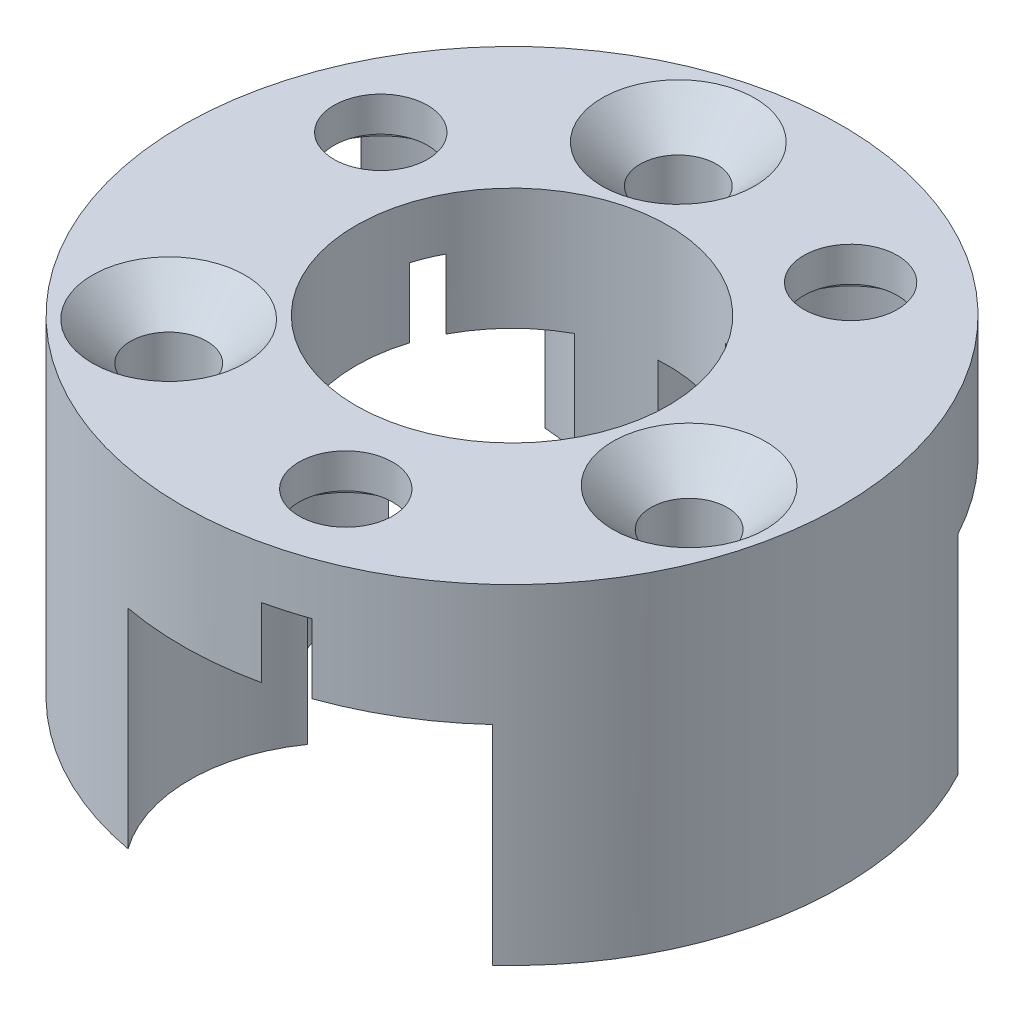
from build123d import *
from build123d.topology import SkipClean

# Parameters (mm, degrees)
SKETCH1_R                                       = 9.5
BOSS_EXTRUDE1_DEPTH                             = 1.5
SKETCH2_R                                       = 4.5
CUT_EXTRUDE1_DEPTH                              = 14.518505835
SKETCH3_R                                       = 2
CUT_EXTRUDE5_DEPTH                              = 0.5
SKETCH4_R                                       = 1.35
CUT_EXTRUDE6_DEPTH                              = 14.518505835
BOSS_EXTRUDE2_DEPTH                             = 2
CIRPATTERN1_OUTLINE_R                           = 1.35
CIRPATTERN1_DEPTH                               = 1.5
CIRPATTERN1_2_OUTLINE_R                         = 2
CIRPATTERN1_2_OUTLINE_R_2                       = 1.35
CIRPATTERN1_2_DEPTH                             = 0.5
BOSS_EXTRUDE3_DEPTH                             = 6.01
CSK_FOR_M2_FLAT_HEAD_MACHINE_SCREW1_D           = 2.2
CSK_FOR_M2_FLAT_HEAD_MACHINE_SCREW1_CSINK_D     = 4.4
CSK_FOR_M2_FLAT_HEAD_MACHINE_SCREW1_CSINK_ANGLE = 90


# Read off the part's stored shape, not the designer's step: CirPattern1, CirPattern2
with BuildPart() as part:
    # Sketch1 → Boss-Extrude1 (new body)
    with BuildSketch(Plane(origin=(0, 0, 0), x_dir=(1, 0, 0), z_dir=(0, 1, 0))):
        with Locations(Location((0, 0, 0), (0, 0, 270))):
            Circle(SKETCH1_R)
    extrude(amount=BOSS_EXTRUDE1_DEPTH)

    # Sketch2 → Cut-Extrude1 (cut, through all)
    with BuildSketch(Plane(origin=(0, 1.5, 0), x_dir=(1, 0, 0), z_dir=(0, 1, 0))):
        with Locations(Location((0, 0, 0), (0, 0, 270))):
            Circle(SKETCH2_R)
    extrude(amount=-CUT_EXTRUDE1_DEPTH, mode=Mode.SUBTRACT)

    # Sketch3 → Cut-Extrude5 (cut)
    with BuildSketch(Plane.XZ):
        with Locations(Location((1.93443789, 6.72740292, 0), (0, 0, 270))):
            Circle(SKETCH3_R)
    extrude(amount=-CUT_EXTRUDE5_DEPTH, mode=Mode.SUBTRACT)

    # Sketch4 → Cut-Extrude6 (cut, through all)
    with BuildSketch(Plane.XZ):
        with Locations(Location((1.93443789, 6.72740292, 0), (0, 0, 270))):
            Circle(SKETCH4_R)
    extrude(amount=-CUT_EXTRUDE6_DEPTH, mode=Mode.SUBTRACT)

    # Sketch5 → Boss-Extrude2 (add)
    with SkipClean():  # the faces are left unmerged after this step: merging them gives an invalid solid
        with BuildSketch(Plane.XZ):
            with BuildLine():
                ThreePointArc((3.182648464, 8.951019425), (4.357780459, 5.933733723), (1.625396676, 4.196198952))
                ThreePointArc((1.625396676, 4.196198952), (4.436036831, 0.756027269), (2.92357195, -3.420924883))
                ThreePointArc((2.92357195, -3.420924883), (6.077241126, -4.155308257), (5.967881507, -7.391507987))
                ThreePointArc((5.967881507, -7.391507987), (9.364966644, 1.596057567), (3.182648464, 8.951019425))
            make_face()
            with BuildLine():
                ThreePointArc((0.851769477, 4.418652369), (-0.540347051, 7.342170761), (2.058000389, 9.274407496))
                ThreePointArc((2.058000389, 9.274407496), (-7.086809251, 6.326700138), (-8.982537647, -3.092574561))
                ThreePointArc((-8.982537647, -3.092574561), (-7.356211508, -0.292572507), (-4.294138699, -1.34550096))
                ThreePointArc((-4.294138699, -1.34550096), (-3.356909645, 2.99685796), (0.851769477, 4.418652369))
            make_face()
            with BuildLine():
                ThreePointArc((-8.534166016, -4.173488997), (-2.625308565, -9.13004682), (5.013839927, -8.069164095))
                ThreePointArc((5.013839927, -8.069164095), (1.922148158, -7.106672419), (2.267302196, -3.887073546))
                ThreePointArc((2.267302196, -3.887073546), (-1.243567215, -4.32475902), (-3.985711115, -2.089044497))
                ThreePointArc((-3.985711115, -2.089044497), (-5.403439375, -5.000228929), (-8.534166016, -4.173488997))
            make_face()
        extrude(amount=BOSS_EXTRUDE2_DEPTH)

    # CirPattern1 outline → CirPattern1 (cut)
    with SkipClean():  # the faces are left unmerged after this step: merging them gives an invalid solid
        with BuildSketch(Plane(origin=(0, 0, 0), x_dir=(1, 0, 0), z_dir=(0, 1, 0))):
            with Locations((4.053593102, 5.706871557)):
                Circle(CIRPATTERN1_OUTLINE_R)
            with Locations((-6.465797695, 2.68206267)):
                Circle(CIRPATTERN1_OUTLINE_R)
        extrude(amount=CIRPATTERN1_DEPTH, mode=Mode.SUBTRACT)

    # CirPattern1 2 outline → CirPattern1 2 (cut)
    # profile 1 of 2: a face of its own
    with SkipClean():  # the faces are left unmerged after this step: merging them gives an invalid solid
        with BuildSketch(Plane(origin=(0, 0, 0), x_dir=(1, 0, 0), z_dir=(0, 1, 0))):
            with Locations((-6.465797695, 2.68206267)):
                Circle(CIRPATTERN1_2_OUTLINE_R)
            with Locations((-6.465797695, 2.68206267)):
                Circle(CIRPATTERN1_2_OUTLINE_R_2, mode=Mode.SUBTRACT)
        # profile 2 of 2: a face of its own
        with BuildSketch(Plane(origin=(0, 0, 0), x_dir=(1, 0, 0), z_dir=(0, 1, 0))):
            with Locations((4.053593102, 5.706871557)):
                Circle(CIRPATTERN1_2_OUTLINE_R)
            with Locations((4.053593102, 5.706871557)):
                Circle(CIRPATTERN1_2_OUTLINE_R_2, mode=Mode.SUBTRACT)
        extrude(amount=CIRPATTERN1_2_DEPTH, mode=Mode.SUBTRACT)

    # Sketch9 → Boss-Extrude3 (add)
    with SkipClean():  # the faces are left unmerged after this step: merging them gives an invalid solid
        with BuildSketch(Plane.XZ.offset(2)):
            with BuildLine():
                ThreePointArc((-9.476901231, 0.662074811), (-6.993614762, 1.786875586), (-4.31661582, 1.271545462))
                ThreePointArc((-4.31661582, 1.271545462), (-3.356909645, 2.99685796), (-1.751062326, 4.145332403))
                ThreePointArc((-1.751062326, 4.145332403), (-2.565519544, 6.746975713), (-1.728461612, 9.341435674))
                ThreePointArc((-1.728461612, 9.341435674), (-7.086809251, 6.326700138), (-9.476901231, 0.662074811))
            make_face()
            with BuildLine():
                ThreePointArc((6.426382202, 6.996542846), (5.757483071, 4.353729492), (3.685500216, 2.582070517))
                ThreePointArc((3.685500216, 2.582070517), (4.436036831, 0.756027269), (4.332720881, -1.215536824))
                ThreePointArc((4.332720881, -1.215536824), (6.874573296, -2.200866602), (8.38110669, -4.472924173))
                ThreePointArc((8.38110669, -4.472924173), (9.364966644, 1.596057567), (6.426382202, 6.996542846))
            make_face()
            with BuildLine():
                ThreePointArc((1.4633337, -9.386621036), (-0.185849196, -7.215887463), (-0.279127779, -4.491334733))
                ThreePointArc((-0.279127779, -4.491334733), (-1.243567215, -4.32475902), (-2.149181875, -3.953608133))
                ThreePointArc((-2.149181875, -3.953608133), (-3.675422752, -6.212474499), (-6.225750314, -7.175655582))
                ThreePointArc((-6.225750314, -7.175655582), (-2.625308565, -9.13004682), (1.4633337, -9.386621036))
            make_face()
        extrude(amount=BOSS_EXTRUDE3_DEPTH)

    # CSK for M2 Flat Head Machine Screw1 (through all)
    with Locations(Plane(origin=(0, 1.5, 0), x_dir=(1, 0, 0), z_dir=(0, 1, 0))):
        with Locations((-1.93443789, 6.72740292)):
            CounterSinkHole(CSK_FOR_M2_FLAT_HEAD_MACHINE_SCREW1_D / 2, CSK_FOR_M2_FLAT_HEAD_MACHINE_SCREW1_CSINK_D / 2, counter_sink_angle=CSK_FOR_M2_FLAT_HEAD_MACHINE_SCREW1_CSINK_ANGLE)

    # CirPattern2 outline → CirPattern2 (revolve, cut)
    with SkipClean():  # the faces are left unmerged after this step: merging them gives an invalid solid
        with BuildSketch(Plane(origin=(6.793320775, 0, 1.688429105), x_dir=(1, 0, 0), z_dir=(0, 0, 1))):
            Polygon((0, -8.01), (1.1, -8.01), (1.1, 0.4), (2.2, 1.5), (0, 1.5), align=None)
        revolve(axis=Axis((6.793320775, 0, 1.688429105), (0, 1, 0)), mode=Mode.SUBTRACT)

    # CirPattern2 2 outline → CirPattern2 2 (revolve, cut)
    with SkipClean():  # the faces are left unmerged after this step: merging them gives an invalid solid
        with BuildSketch(Plane(origin=(-4.858882885, 0, 5.038973815), x_dir=(1, 0, 0), z_dir=(0, 0, 1))):
            Polygon((0, -8.01), (1.1, -8.01), (1.1, 0.4), (2.2, 1.5), (0, 1.5), align=None)
        revolve(axis=Axis((-4.858882885, 0, 5.038973815), (0, 1, 0)), mode=Mode.SUBTRACT)


solid = part.part
